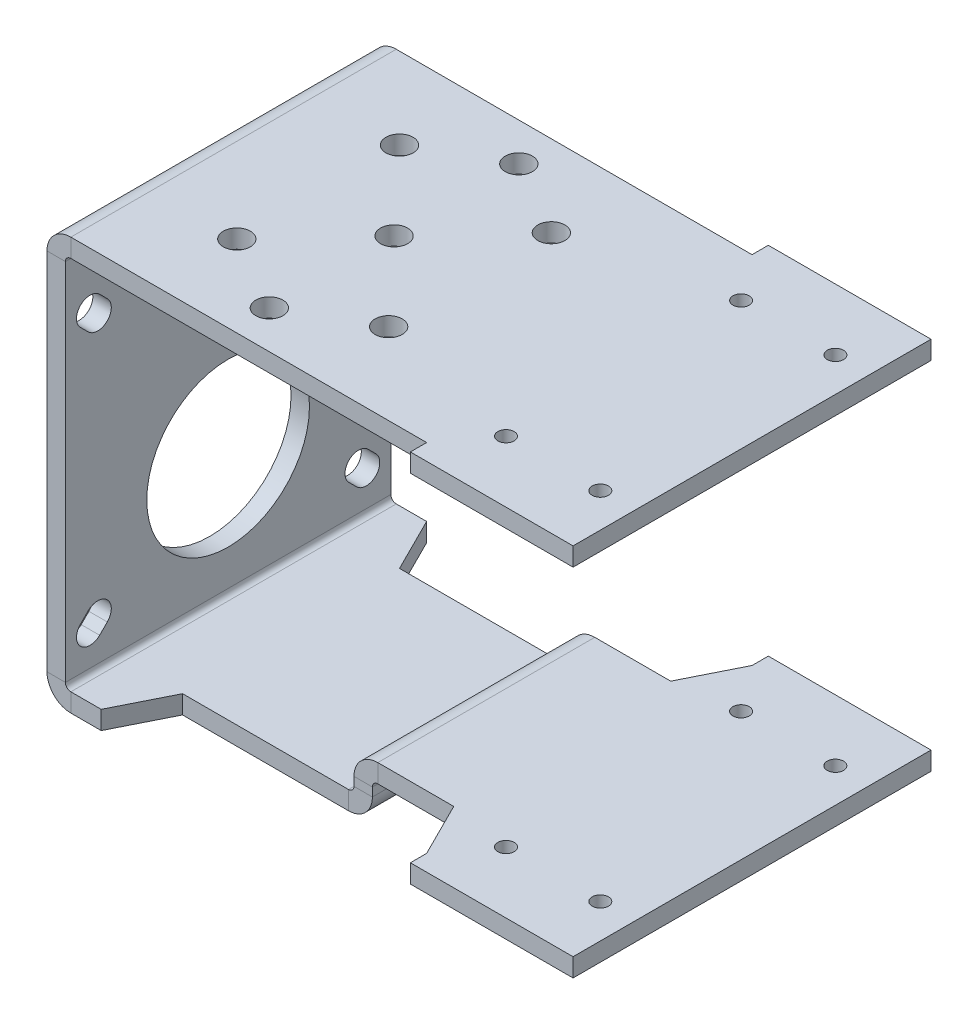
from build123d import *

# Parameters (mm, degrees)
BASE_FLANGE1_DEPTH      = 60
SKETCH6_R               = 15
CUT_EXTRUDE1_DEPTH      = 3.4
CUT_EXTRUDE2_START      = -65
CUT_EXTRUDE2_OUTLINE_W  = 10
CUT_EXTRUDE2_OUTLINE_H  = 10.4
CUT_EXTRUDE2_DEPTH      = 50
SKETCH10_W              = 3
SKETCH10_H              = 3.4
BOSS_EXTRUDE1_DEPTH     = 30
MIRROR2_COPY_1_SKETCH_W = 3
MIRROR2_COPY_1_SKETCH_H = 3.4
MIRROR2_COPY_1_DEPTH    = 30
SKETCH13_R              = 1.5
CUT_EXTRUDE3_DEPTH      = 141.516902898
CUT_EXTRUDE6_REACH      = 142.517
SKETCH14_R              = 2.5
CUT_EXTRUDE7_START      = -3.4
CUT_EXTRUDE7_DEPTH      = 10.4


# Read off the part's stored shape, not the designer's step: Cut-Extrude2
# Sheet-metal steps are written as plain solids
with BuildPart() as part:
    # Sketch1 → Base-Flange1 (new body)
    with BuildSketch(Plane.XY):
        with BuildLine():
            Line((100, 0), (4.4, 0))
            ThreePointArc((4.4, 0), (1.288730163, -1.288730163), (0, -4.4))
            Line((0, -4.4), (0, -71.6))
            ThreePointArc((0, -71.6), (1.288730163, -74.711269837), (4.4, -76))
            Line((4.4, -76), (45.6, -76))
            ThreePointArc((45.6, -76), (48.711269837, -74.711269837), (50, -71.6))
            Line((50, -71.6), (50, -70))
            ThreePointArc((50, -70), (50.292893219, -69.292893219), (51, -69))
            Line((51, -69), (100, -69))
            Line((100, -69), (100, -65.6))
            Line((100, -65.6), (51, -65.6))
            ThreePointArc((51, -65.6), (47.888730163, -66.888730163), (46.6, -70))
            Line((46.6, -70), (46.6, -71.6))
            ThreePointArc((46.6, -71.6), (46.307106781, -72.307106781), (45.6, -72.6))
            Line((45.6, -72.6), (4.4, -72.6))
            ThreePointArc((4.4, -72.6), (3.692893219, -72.307106781), (3.4, -71.6))
            Line((3.4, -71.6), (3.4, -4.4))
            ThreePointArc((3.4, -4.4), (3.692893219, -3.692893219), (4.4, -3.4))
            Line((4.4, -3.4), (100, -3.4))
            Line((100, -3.4), (100, 0))
        make_face()
    extrude(amount=BASE_FLANGE1_DEPTH)

    # Sketch6 → Cut-Extrude1 (cut)
    with BuildSketch(Plane.ZY):
        with Locations(Location((30, -50, 0), (0, 0, 270))):
            Circle(SKETCH6_R)
        with BuildLine():
            Line((57.224873734, -63.689339828), (55.810660172, -62.275126266))
            ThreePointArc((55.810660172, -62.275126266), (52.275126266, -62.275126266), (52.275126266, -65.810660172))
            Line((52.275126266, -65.810660172), (53.689339828, -67.224873734))
            ThreePointArc((53.689339828, -67.224873734), (57.224873734, -67.224873734), (57.224873734, -63.689339828))
        make_face()
        with BuildLine():
            Line((2.775126266, -16.310660172), (4.189339828, -17.724873734))
            ThreePointArc((4.189339828, -17.724873734), (7.724873734, -17.724873734), (7.724873734, -14.189339828))
            Line((7.724873734, -14.189339828), (6.310660172, -12.775126266))
            ThreePointArc((6.310660172, -12.775126266), (2.775126266, -12.775126266), (2.775126266, -16.310660172))
        make_face()
        with BuildLine():
            Line((53.689339828, -12.775126266), (52.275126266, -14.189339828))
            ThreePointArc((52.275126266, -14.189339828), (52.275126266, -17.724873734), (55.810660172, -17.724873734))
            Line((55.810660172, -17.724873734), (57.224873734, -16.310660172))
            ThreePointArc((57.224873734, -16.310660172), (57.224873734, -12.775126266), (53.689339828, -12.775126266))
        make_face()
        with BuildLine():
            Line((6.310660172, -67.224873734), (7.724873734, -65.810660172))
            ThreePointArc((7.724873734, -65.810660172), (7.724873734, -62.275126266), (4.189339828, -62.275126266))
            Line((4.189339828, -62.275126266), (2.775126266, -63.689339828))
            ThreePointArc((2.775126266, -63.689339828), (2.775126266, -67.224873734), (6.310660172, -67.224873734))
        make_face()
    extrude(amount=-CUT_EXTRUDE1_DEPTH, mode=Mode.SUBTRACT)

    # Cut-Extrude2 outline → Cut-Extrude2 (cut)
    with BuildSketch(Plane.ZY.offset(CUT_EXTRUDE2_START)):
        with Locations((55, -70.8)):
            Rectangle(CUT_EXTRUDE2_OUTLINE_W, CUT_EXTRUDE2_OUTLINE_H)
        with Locations((5, -70.8)):
            Rectangle(CUT_EXTRUDE2_OUTLINE_W, CUT_EXTRUDE2_OUTLINE_H)
    extrude(amount=CUT_EXTRUDE2_DEPTH, mode=Mode.SUBTRACT)

    # Sketch10 → Boss-Extrude1 (add)
    with BuildSketch(Plane(origin=(100, 0, 0), x_dir=(0, 0, -1), z_dir=(1, 0, 0))):
        with Locations((1.5, -1.7)):
            Rectangle(SKETCH10_W, SKETCH10_H)
    boss_extrude1 = extrude(amount=-BOSS_EXTRUDE1_DEPTH)

    # Mirror1: Boss-Extrude1 across plane
    add(boss_extrude1.mirror(Plane(origin=(0, 0, 30), x_dir=(1, 0, 0), z_dir=(0, 0, -1))))

    # Mirror2: Boss-Extrude1 across plane
    add(boss_extrude1.mirror(Plane(origin=(0, -34.5, 0), x_dir=(0, 0, 1), z_dir=(0, -1, 0))))

    # Mirror2 copy 1 sketch → Mirror2 copy 1 (add)
    with BuildSketch(Plane(origin=(100, -69, 60), x_dir=(0, 0, 1), z_dir=(1, 0, 0))):
        with Locations((1.5, -1.7)):
            Rectangle(MIRROR2_COPY_1_SKETCH_W, MIRROR2_COPY_1_SKETCH_H)
    extrude(amount=-MIRROR2_COPY_1_DEPTH)

    # Sketch13 → Cut-Extrude3 (cut, through all)
    with BuildSketch(Plane(origin=(0, 0, 0), x_dir=(1, 0, 0), z_dir=(0, 1, 0))):
        with Locations(Location((76.306667563, -8.329371406, 0), (0, 0, 270))):
            Circle(SKETCH13_R)
        with Locations(Location((93.693332437, -8.329371406, 0), (0, 0, 270))):
            Circle(SKETCH13_R)
    cut_extrude3 = extrude(amount=-CUT_EXTRUDE3_DEPTH, mode=Mode.SUBTRACT)

    # Mirror3: Cut-Extrude3 across plane
    add(cut_extrude3.mirror(Plane(origin=(0, 0, 30), x_dir=(1, 0, 0), z_dir=(0, 0, -1))), mode=Mode.SUBTRACT)

    # Sketch14 → Cut-Extrude6 (cut, up to next)
    with BuildSketch(Plane(origin=(0, 0, 0), x_dir=(1, 0, 0), z_dir=(0, 1, 0)), mode=Mode.PRIVATE) as cut_extrude6_sk1:
        with Locations(Location((20, -15, 0), (0, 0, 270))):
            Circle(SKETCH14_R)
    cut_extrude6_tool1 = extrude(cut_extrude6_sk1.sketch, amount=-CUT_EXTRUDE6_REACH, mode=Mode.PRIVATE) & part.part
    # Sketch14 → Cut-Extrude6 (cut, up to next)
    with BuildSketch(Plane(origin=(0, 0, 0), x_dir=(1, 0, 0), z_dir=(0, 1, 0)), mode=Mode.PRIVATE) as cut_extrude6_sk2:
        with Locations(Location((48, -15, 0), (0, 0, 270))):
            Circle(SKETCH14_R)
    cut_extrude6_tool2 = extrude(cut_extrude6_sk2.sketch, amount=-CUT_EXTRUDE6_REACH, mode=Mode.PRIVATE) & part.part
    # Sketch14 → Cut-Extrude6 (cut, up to next)
    with BuildSketch(Plane(origin=(0, 0, 0), x_dir=(1, 0, 0), z_dir=(0, 1, 0)), mode=Mode.PRIVATE) as cut_extrude6_sk3:
        with Locations(Location((48, -45, 0), (0, 0, 270))):
            Circle(SKETCH14_R)
    cut_extrude6_tool3 = extrude(cut_extrude6_sk3.sketch, amount=-CUT_EXTRUDE6_REACH, mode=Mode.PRIVATE) & part.part
    # Sketch14 → Cut-Extrude6 (cut, up to next)
    with BuildSketch(Plane(origin=(0, 0, 0), x_dir=(1, 0, 0), z_dir=(0, 1, 0)), mode=Mode.PRIVATE) as cut_extrude6_sk4:
        with Locations(Location((20, -45, 0), (0, 0, 270))):
            Circle(SKETCH14_R)
    cut_extrude6_tool4 = extrude(cut_extrude6_sk4.sketch, amount=-CUT_EXTRUDE6_REACH, mode=Mode.PRIVATE) & part.part
    # Sketch14 → Cut-Extrude6 (cut, up to next)
    with BuildSketch(Plane(origin=(0, 0, 0), x_dir=(1, 0, 0), z_dir=(0, 1, 0)), mode=Mode.PRIVATE) as cut_extrude6_sk5:
        with Locations(Location((34, -30, 0), (0, 0, 270))):
            Circle(SKETCH14_R)
    cut_extrude6_tool5 = extrude(cut_extrude6_sk5.sketch, amount=-CUT_EXTRUDE6_REACH, mode=Mode.PRIVATE) & part.part
    # Sketch14 → Cut-Extrude6 (cut, up to next)
    with BuildSketch(Plane(origin=(0, 0, 0), x_dir=(1, 0, 0), z_dir=(0, 1, 0)), mode=Mode.PRIVATE) as cut_extrude6_sk6:
        with Locations(Location((34, -7, 0), (0, 0, 270))):
            Circle(SKETCH14_R)
    cut_extrude6_tool6 = extrude(cut_extrude6_sk6.sketch, amount=-CUT_EXTRUDE6_REACH, mode=Mode.PRIVATE) & part.part
    # Sketch14 → Cut-Extrude6 (cut, up to next)
    with BuildSketch(Plane(origin=(0, 0, 0), x_dir=(1, 0, 0), z_dir=(0, 1, 0)), mode=Mode.PRIVATE) as cut_extrude6_sk7:
        with Locations(Location((34, -53, 0), (0, 0, 270))):
            Circle(SKETCH14_R)
    cut_extrude6_tool7 = extrude(cut_extrude6_sk7.sketch, amount=-CUT_EXTRUDE6_REACH, mode=Mode.PRIVATE) & part.part
    add(cut_extrude6_tool1.solids().sort_by_distance((20, 0, 15))[0], mode=Mode.SUBTRACT)
    add(cut_extrude6_tool2.solids().sort_by_distance((48, 0, 15))[0], mode=Mode.SUBTRACT)
    add(cut_extrude6_tool3.solids().sort_by_distance((48, 0, 45))[0], mode=Mode.SUBTRACT)
    add(cut_extrude6_tool4.solids().sort_by_distance((20, 0, 45))[0], mode=Mode.SUBTRACT)
    add(cut_extrude6_tool5.solids().sort_by_distance((34, 0, 30))[0], mode=Mode.SUBTRACT)
    add(cut_extrude6_tool6.solids().sort_by_distance((34, 0, 7))[0], mode=Mode.SUBTRACT)
    add(cut_extrude6_tool7.solids().sort_by_distance((34, 0, 53))[0], mode=Mode.SUBTRACT)

    # Sketch15 → Cut-Extrude7 (cut)
    with BuildSketch(Plane.XZ.offset(69).offset(CUT_EXTRUDE7_START)):
        Polygon((65, 50), (70, 60), (65, 60), align=None)
        Polygon((15, 50), (15, 60), (10, 60), align=None)
    cut_extrude7 = extrude(amount=CUT_EXTRUDE7_DEPTH, mode=Mode.SUBTRACT)

    # Mirror4: Cut-Extrude7 across plane
    add(cut_extrude7.mirror(Plane(origin=(0, 0, 30), x_dir=(1, 0, 0), z_dir=(0, 0, -1))), mode=Mode.SUBTRACT)


solid = part.part
